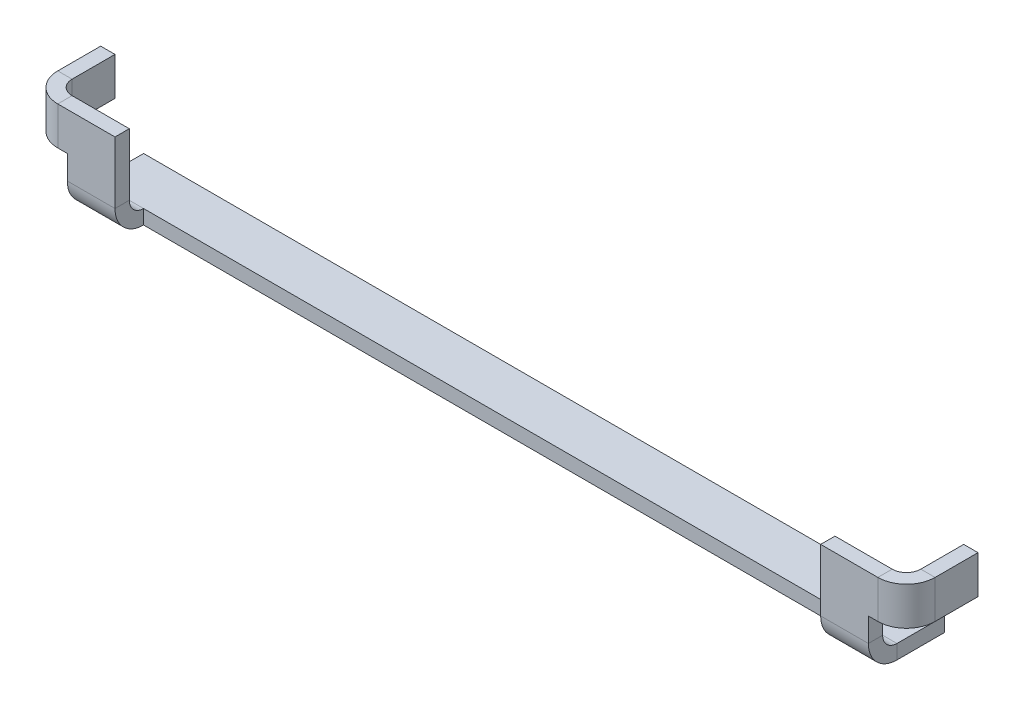
from build123d import *

# Parameters (mm, degrees)
BOSS_EXTRUDE1_DEPTH        = 1.5
SKETCH3_W                  = 5
SKETCH3_H                  = 1.5
BOSS_EXTRUDE2_DEPTH        = 8
BOSS_EXTRUDE3_DEPTH        = 6
BOSS_EXTRUDE3_DEPTH_BACK   = 1.5
SKETCH4_W                  = 1.5
SKETCH4_H                  = 4
BOSS_EXTRUDE3_2_DEPTH      = 6
BOSS_EXTRUDE3_2_DEPTH_BACK = 1.5
SKETCH5_W                  = 2.5
SKETCH5_H                  = 1.5
BOSS_EXTRUDE4_DEPTH        = 4
CONVERT_SOLID2_START       = 5.5
CONVERT_SOLID2_DEPTH       = 4
CONVERT_SOLID2_START_2     = -42
CONVERT_SOLID2_2_DEPTH     = 5
CONVERT_SOLID2_START_3     = 37
CONVERT_SOLID2_3_DEPTH     = 5
CONVERT_SOLID2_4_DEPTH     = 4
CONVERT_SOLID2_5_DEPTH     = 84
CUT_EXTRUDE1_DEPTH         = 10


# Read off the part's stored shape, not the designer's step: Convert-Solid2
with BuildPart() as part:
    # Sketch1 → Boss-Extrude1 (new body)
    with BuildSketch(Plane(origin=(0, 0, 0), x_dir=(1, 0, 0), z_dir=(0, 1, 0))):
        Polygon((-42, -45.5), (-42, -42.5), (-45, -42.5), (-45, 42.5), (45, 42.5), (45, -42.5), (42, -42.5), (42, -45.5), (37, -45.5), (37, -42.5), (-37, -42.5), (-37, -45.5), align=None)
    extrude(amount=BOSS_EXTRUDE1_DEPTH)

    # Sketch3 → Boss-Extrude2 (add)
    with BuildSketch(Plane(origin=(0, 1.5, 0), x_dir=(1, 0, 0), z_dir=(0, 1, 0))):
        with Locations((-39.5, -44.75)):
            Rectangle(SKETCH3_W, SKETCH3_H)
        with Locations((39.5, -44.75)):
            Rectangle(SKETCH3_W, SKETCH3_H)
    extrude(amount=BOSS_EXTRUDE2_DEPTH)



with BuildPart() as body_2:
    # Sketch4 → Boss-Extrude3 (new, two sides: drawn at the far end of the back side and taken through both)
    with BuildSketch(Plane(origin=(0, 0, 44), x_dir=(-1, 0, 0), z_dir=(0, 0, -1)).offset(-BOSS_EXTRUDE3_DEPTH_BACK)):
        with Locations((45.25, 7.5)):
            Rectangle(SKETCH4_W, SKETCH4_H)
    extrude(amount=BOSS_EXTRUDE3_DEPTH + BOSS_EXTRUDE3_DEPTH_BACK)


with BuildPart() as body_3:
    # Sketch4 → Boss-Extrude3 2 (new, two sides: drawn at the far end of the back side and taken through both)
    with BuildSketch(Plane(origin=(0, 0, 44), x_dir=(-1, 0, 0), z_dir=(0, 0, -1)).offset(-BOSS_EXTRUDE3_2_DEPTH_BACK)):
        with Locations((-45.25, 7.5)):
            Rectangle(SKETCH4_W, SKETCH4_H)
    extrude(amount=BOSS_EXTRUDE3_2_DEPTH + BOSS_EXTRUDE3_2_DEPTH_BACK)


with BuildPart() as part_1:
    add(part.part)

    add(body_2.part)  # Boss-Extrude4 merges body 2

    add(body_3.part)  # Boss-Extrude4 merges body 3
    # Sketch5 → Boss-Extrude4 (add)
    with BuildSketch(Plane(origin=(0, 9.5, 0), x_dir=(1, 0, 0), z_dir=(0, 1, 0))):
        with Locations((-43.25, -44.75)):
            Rectangle(SKETCH5_W, SKETCH5_H)
        with Locations((43.25, -44.75)):
            Rectangle(SKETCH5_W, SKETCH5_H)
    extrude(amount=-BOSS_EXTRUDE4_DEPTH)

    # Convert-Solid2 outline → Convert-Solid2 (add)
    with BuildSketch(Plane(origin=(0, 0, 0), x_dir=(1, 0, 0), z_dir=(0, 1, 0)).offset(CONVERT_SOLID2_START)):
        with BuildLine():
            ThreePointArc((44.5, -42.5), (44.060660172, -43.560660172), (43, -44))
            Line((43, -44), (44.5, -44))
            Line((44.5, -44), (44.5, -42.5))
        make_face()
        with BuildLine():
            ThreePointArc((-43, -44), (-44.060660172, -43.560660172), (-44.5, -42.5))
            Line((-44.5, -42.5), (-44.5, -44))
            Line((-44.5, -44), (-43, -44))
        make_face()
    extrude(amount=CONVERT_SOLID2_DEPTH)

    # Convert-Solid2 2 outline → Convert-Solid2 2 (add)
    with BuildSketch(Plane.YZ.offset(CONVERT_SOLID2_START_2)):
        with BuildLine():
            ThreePointArc((1.5, 42.5), (1.939339828, 43.560660172), (3, 44))
            Line((3, 44), (1.5, 44))
            Line((1.5, 44), (1.5, 42.5))
        make_face()
    extrude(amount=CONVERT_SOLID2_2_DEPTH)

    # Convert-Solid2 3 outline → Convert-Solid2 3 (add)
    with BuildSketch(Plane.YZ.offset(CONVERT_SOLID2_START_3)):
        with BuildLine():
            ThreePointArc((1.5, 42.5), (1.939339828, 43.560660172), (3, 44))
            Line((3, 44), (1.5, 44))
            Line((1.5, 44), (1.5, 42.5))
        make_face()
    extrude(amount=CONVERT_SOLID2_3_DEPTH)

    # Convert-Solid2 4 outline → Convert-Solid2 4 (cut)
    with BuildSketch(Plane(origin=(0, 0, 0), x_dir=(1, 0, 0), z_dir=(0, 1, 0)).offset(CONVERT_SOLID2_START)):
        with BuildLine():
            ThreePointArc((46, -42.5), (45.121320344, -44.621320344), (43, -45.5))
            Line((43, -45.5), (46, -45.5))
            Line((46, -45.5), (46, -42.5))
        make_face()
        with BuildLine():
            ThreePointArc((-43, -45.5), (-45.121320344, -44.621320344), (-46, -42.5))
            Line((-46, -42.5), (-46, -45.5))
            Line((-46, -45.5), (-43, -45.5))
        make_face()
    extrude(amount=CONVERT_SOLID2_4_DEPTH, mode=Mode.SUBTRACT)

    # Convert-Solid2 5 outline → Convert-Solid2 5 (cut)
    with BuildSketch(Plane.YZ.offset(CONVERT_SOLID2_START_2)):
        with BuildLine():
            ThreePointArc((0, 42.5), (0.878679656, 44.621320344), (3, 45.5))
            Line((3, 45.5), (0, 45.5))
            Line((0, 45.5), (0, 42.5))
        make_face()
    extrude(amount=CONVERT_SOLID2_5_DEPTH, mode=Mode.SUBTRACT)

    # Sketch6 → Cut-Extrude1 (cut)
    with BuildSketch(Plane(origin=(0, 1.5, 0), x_dir=(1, 0, 0), z_dir=(0, 1, 0))):
        Polygon((-45, 42.5), (45, 42.5), (45, -37.5), (45, -42.5), (42, -42.5), (42, -37.5), (-42, -37.5), (-42, -42.5), (-45, -42.5), (-45, -37.5), align=None)
    extrude(amount=-CUT_EXTRUDE1_DEPTH, mode=Mode.SUBTRACT)


solid = part_1.part
